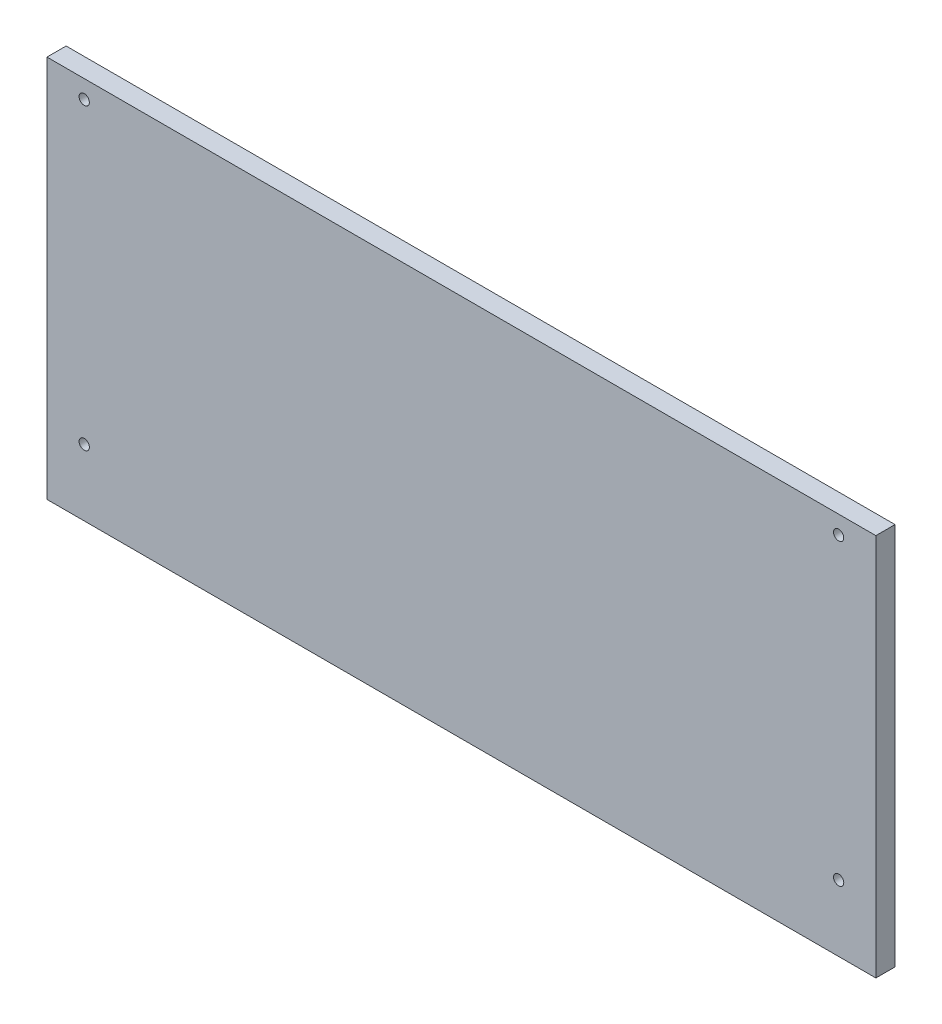
from build123d import *

# Parameters (mm, degrees)
SKETCH1_W            = 274.7772
SKETCH1_H            = 127
BOSS_EXTRUDE1_DEPTH  = 6.35
M3_CLEARANCE_HOLE1_D = 3.4


with BuildPart() as part:
    # Sketch1 → Boss-Extrude1 (new body)
    with BuildSketch(Plane.XY):
        with Locations((137.3886, 63.5)):
            Rectangle(SKETCH1_W, SKETCH1_H)
    extrude(amount=BOSS_EXTRUDE1_DEPTH)

    # M3 Clearance Hole1 (through all)
    with Locations(Plane.XY.offset(6.35)):
        with Locations((12.3444, 121.0056), (12.3444, 21.9964), (262.4328, 21.9964), (262.4328, 121.0056)):
            Hole(M3_CLEARANCE_HOLE1_D / 2)


solid = part.part
